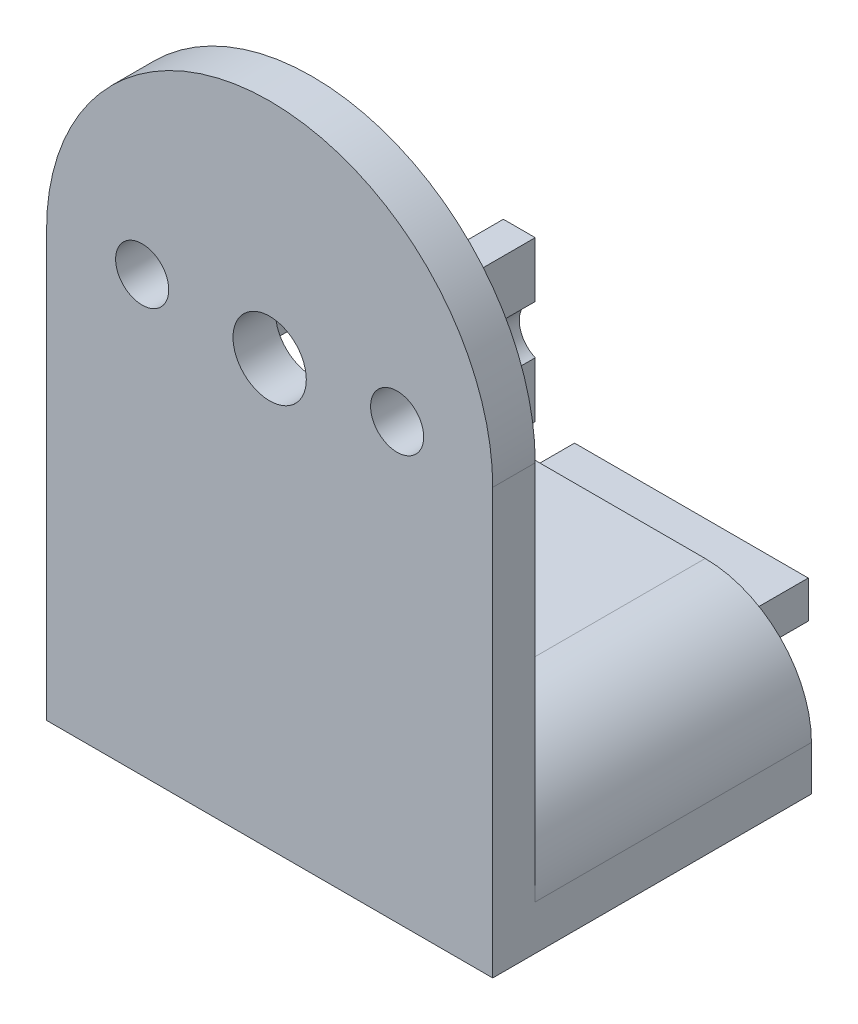
from build123d import *
from build123d.topology import SkipClean

# Parameters (mm, degrees)
BOSS_EXTRUDE1_DEPTH      = 11
BOSS_EXTRUDE1_DEPTH_BACK = 3.2
SKETCH1_W                = 42
SKETCH1_H                = 30
BOSS_EXTRUDE2_DEPTH      = 9.7
SKETCH13_R               = 3.45
BOSS_EXTRUDE6_DEPTH      = 4
BOSS_EXTRUDE7_DEPTH      = 10
CUT_EXTRUDE4_REACH       = 76.023
SKETCH14_5_R             = 2.5
CUT_EXTRUDE5_DEPTH       = 69.601117718
CUT_EXTRUDE5_DEPTH_BACK  = 69.601117718
SKETCH15_R               = 1.75
FILLET3_R                = 10


with BuildPart() as part:
    # Sketch1 → Boss-Extrude1 (new, two sides: drawn at the far end of the back side and taken through both)
    with BuildSketch(Plane(origin=(0, 0, 0), x_dir=(1, 0, 0), z_dir=(0, 1, 0)).offset(-BOSS_EXTRUDE1_DEPTH_BACK)):
        with Locations((-8.394509147, -7.897016229)):
            Rectangle(SKETCH1_W, SKETCH1_H)
    extrude(amount=BOSS_EXTRUDE1_DEPTH + BOSS_EXTRUDE1_DEPTH_BACK)

    # Sketch2 → Boss-Extrude2 (add)
    with BuildSketch(Plane(origin=(0, 0, -7.102983771), x_dir=(-1, 0, 0), z_dir=(0, 0, -1))):
        Polygon((8.394509147, 4.557110743), (-2.605490853, 4.557110743), (-2.605490853, 1.043971306), (19.394509147, 1.043971306), (19.394509147, 4.557110743), align=None)
    extrude(amount=BOSS_EXTRUDE2_DEPTH)

    # Sketch13 → Boss-Extrude6 (add)
    with BuildSketch(Plane.XY.offset(22.897016229)):
        with BuildLine():
            Line((-29.394509147, 11), (12.605490853, 11))
            Line((12.605490853, 11), (12.605490853, 36.8))
            ThreePointArc((12.605490853, 36.8), (-8.394509147, 57.8), (-29.394509147, 36.8))
            Line((-29.394509147, 36.8), (-29.394509147, 11))
        make_face()
        with Locations((-8.394509147, 36.8)):
            Circle(SKETCH13_R, mode=Mode.SUBTRACT)
    extrude(amount=-BOSS_EXTRUDE6_DEPTH)

    # Sketch14 → Boss-Extrude7 (add)
    with BuildSketch(Plane(origin=(0, 0, 18.897016229), x_dir=(-1, 0, 0), z_dir=(0, 0, -1))):
        with BuildLine():
            Line((19.394509147, 45.155290068), (16.394509147, 45.155290068))
            Line((16.394509147, 45.155290068), (16.394509147, 30.155290068))
            Line((16.394509147, 30.155290068), (19.394509147, 30.155290068))
            Line((19.394509147, 30.155290068), (19.394509147, 35.36400222))
            ThreePointArc((19.394509147, 35.36400222), (17.894509147, 37.655290068), (19.394509147, 39.946577915))
            Line((19.394509147, 39.946577915), (19.394509147, 45.155290068))
        make_face()
    boss_extrude7 = extrude(amount=BOSS_EXTRUDE7_DEPTH)

    # Sketch14<5> → Cut-Extrude4 (cut, up to next)
    with BuildSketch(Plane(origin=(0, 0, 18.897016229), x_dir=(-1, 0, 0), z_dir=(0, 0, -1)), mode=Mode.PRIVATE) as cut_extrude4_sk1:
        with Locations((20.394509147, 37.655290068)):
            Circle(SKETCH14_5_R)
    cut_extrude4_tool1 = extrude(cut_extrude4_sk1.sketch, amount=-CUT_EXTRUDE4_REACH, mode=Mode.PRIVATE) & part.part
    cut_extrude4 = cut_extrude4_tool1.solids().sort_by_distance((-20.394509, 37.65529, 18.897016))[0]
    add(cut_extrude4, mode=Mode.SUBTRACT)

    # Mirror1: Boss-Extrude7, Cut-Extrude4 across plane
    with SkipClean():  # the faces are left unmerged after this step: merging them gives an invalid solid
        add(boss_extrude7.mirror(Plane.ZY.offset(8.394509147)))
        add(cut_extrude4.mirror(Plane.ZY.offset(8.394509147)), mode=Mode.SUBTRACT)

    # Sketch15 → Cut-Extrude5 (cut, two sides: drawn at the far end of the back side and taken through both)
    with SkipClean():  # the faces are left unmerged after this step: merging them gives an invalid solid
        with BuildSketch(Plane(origin=(-16.394509147, 0, 0), x_dir=(0, 0, -1), z_dir=(1, 0, 0)).offset(-CUT_EXTRUDE5_DEPTH_BACK)):
            with Locations((-13.558051203, 38.023895041)):
                Circle(SKETCH15_R)
        extrude(amount=CUT_EXTRUDE5_DEPTH + CUT_EXTRUDE5_DEPTH_BACK, mode=Mode.SUBTRACT)

    # Fillet3
    fillet3_edges = [part.edges().sort_by_distance(p)[0] for p in [
        (-29.394509147, 11, 5.897016229),
        (12.605490853, 11, 5.897016229),
    ]]
    fillet(fillet3_edges, radius=FILLET3_R)


solid = part.part
